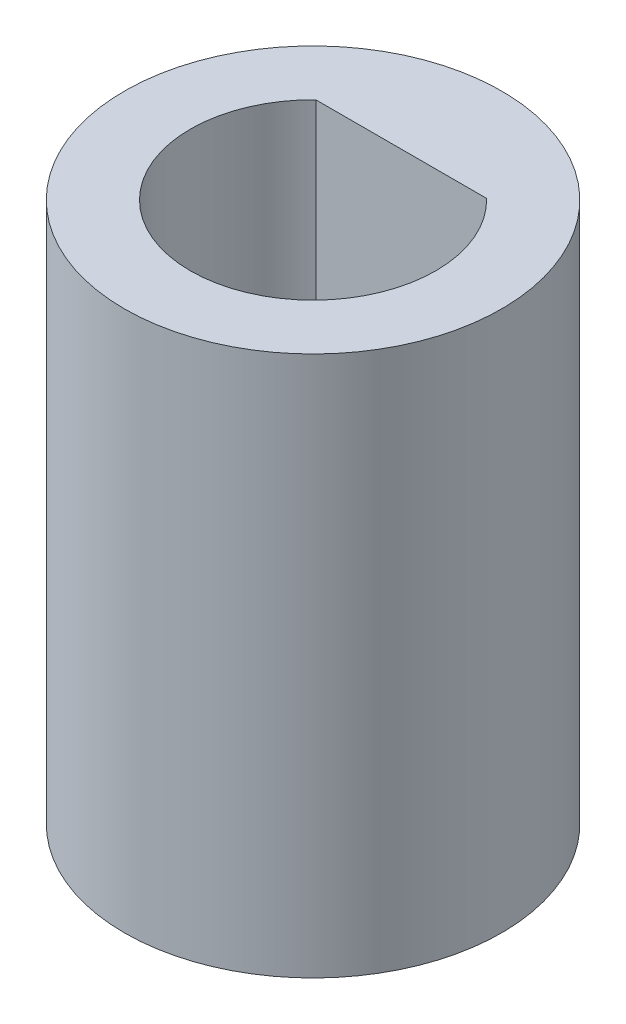
from build123d import *

# Parameters (mm, degrees)
SKETCH1_R           = 5.725
BOSS_EXTRUDE1_DEPTH = 16.4
CUT_EXTRUDE1_DEPTH  = 19.289648712


with BuildPart() as part:
    # Sketch1 → Boss-Extrude1 (new body)
    with BuildSketch(Plane(origin=(0, 0, 0), x_dir=(1, 0, 0), z_dir=(0, 1, 0))):
        Circle(SKETCH1_R)
    extrude(amount=-BOSS_EXTRUDE1_DEPTH)

    # Sketch3 → Cut-Extrude1 (cut, through all)
    with BuildSketch(Plane(origin=(0, 0, 0), x_dir=(1, 0, 0), z_dir=(0, 1, 0))):
        with BuildLine():
            Line((-2.592296279, 2.675), (2.592296279, 2.675))
            ThreePointArc((2.592296279, 2.675), (0, -3.725), (-2.592296279, 2.675))
        make_face()
    extrude(amount=-CUT_EXTRUDE1_DEPTH, mode=Mode.SUBTRACT)


solid = part.part
